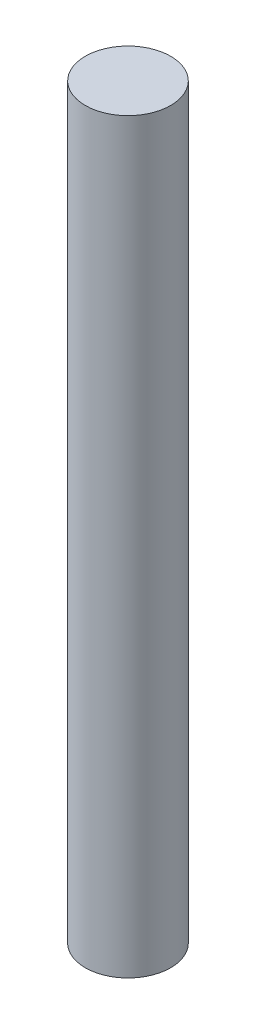
from build123d import *

# Parameters (mm, degrees)
SKETCH1_R           = 2
BOSS_EXTRUDE1_DEPTH = 35


with BuildPart() as part:
    # Sketch1 → Boss-Extrude1 (new body)
    with BuildSketch(Plane(origin=(0, 0, 0), x_dir=(1, 0, 0), z_dir=(0, 1, 0))):
        Circle(SKETCH1_R)
    extrude(amount=BOSS_EXTRUDE1_DEPTH)


solid = part.part
